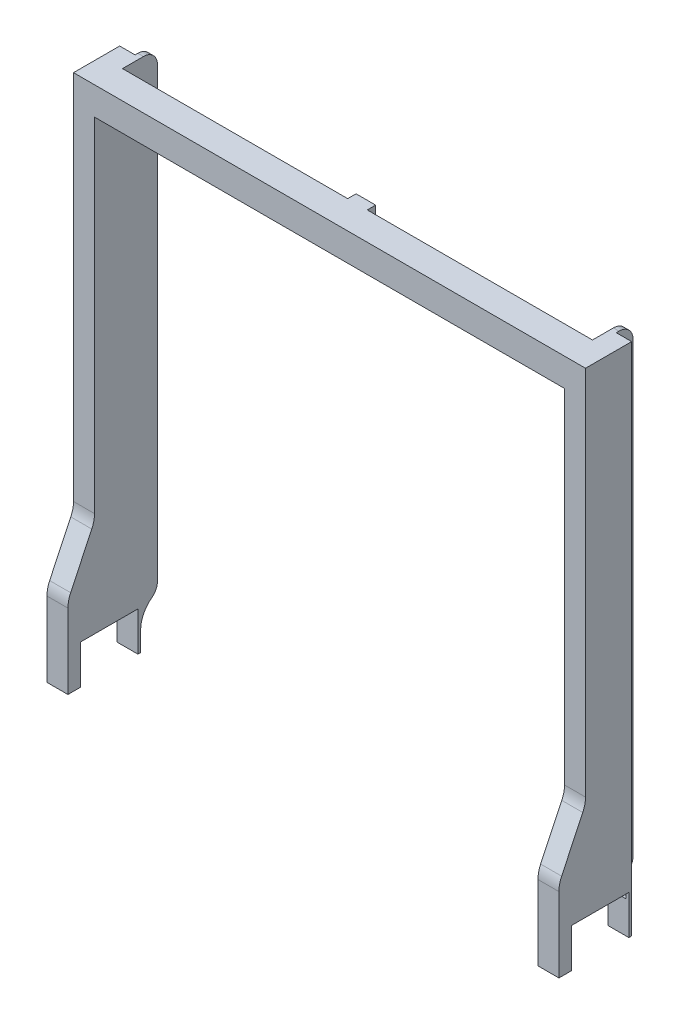
from build123d import *

# Parameters (mm, degrees)
EXTRUDE_1_DEPTH        = 26
EXTRUDE_2_DEPTH        = 19
FILLET_1_R             = 10
SKETCH_5_W             = 161
SKETCH_5_H             = 6
CUT_EXTRUDE_1_DEPTH    = 52
SKETCH_1_5_W           = 11
SKETCH_1_5_H           = 340
EXTRUDE_4_DEPTH        = 7
SKETCH_6_W             = 1.9
SKETCH_6_H             = 2
SKETCH_6_W_2           = 6.6
EXTRUDE_5_DEPTH        = 28
SKETCH_6_3_W           = 6.6
SKETCH_6_3_H           = 2
CUT_EXTRUDE_2_DEPTH    = 5
FILLET_2_R             = 20
SKETCH_6_4_W           = 15
SKETCH_6_4_H           = 10
SKETCH_6_4_H_2         = 9
EXTRUDE_6_DEPTH        = 30
SKETCH_6_5_W           = 15
SKETCH_6_5_H           = 9
EXTRUDE_7_DEPTH        = 28
EXTRUDE_8_DEPTH        = 15
FILLET_3_R             = 20
FILLET_3_OF_MIRROR_2_R = 20
FILLET_4_R             = 20


with BuildPart() as part:
    # 스케치1 → 보스-돌출1 (new body)
    with BuildSketch(Plane.XY):
        Polygon((-168, 0), (168, 0), (183, 0), (183, -340), (168, -340), (168, -20), (-168, -20), (-168, -340), (-183, -340), (-183, 0), align=None)
    extrude(amount=EXTRUDE_1_DEPTH)

    # 스케치1<4> → 보스-돌출2 (add)
    with BuildSketch(Plane.XY):
        Polygon((172, 0), (168, 0), (168, -20), (168, -340), (172, -340), align=None)
        Polygon((-168, -20), (-168, 0), (-172, 0), (-172, -340), (-168, -340), align=None)
    extrude(amount=-EXTRUDE_2_DEPTH)

    # 필렛1
    fillet_1_edges = [part.edges().sort_by_distance(p)[0] for p in [
        (170, 0, -19),
        (170, -340, -19),
        (-170, -340, -19),
        (-170, 0, -19),
    ]]
    fillet(fillet_1_edges, radius=FILLET_1_R)

    # 스케치5 → 컷-돌출1 (cut)
    with BuildSketch(Plane(origin=(0, 0, 0), x_dir=(1, 0, 0), z_dir=(0, 1, 0))):
        with Locations((-87.5, -3)):
            Rectangle(SKETCH_5_W, SKETCH_5_H)
        with Locations((87.5, -3)):
            Rectangle(SKETCH_5_W, SKETCH_5_H)
    extrude(amount=-CUT_EXTRUDE_1_DEPTH, mode=Mode.SUBTRACT)

    # 스케치1<5> → 보스-돌출4 (add)
    with BuildSketch(Plane.XY):
        with Locations((177.5, -170)):
            Rectangle(SKETCH_1_5_W, SKETCH_1_5_H)
        with Locations((-177.5, -170)):
            Rectangle(SKETCH_1_5_W, SKETCH_1_5_H)
    extrude(amount=-EXTRUDE_4_DEPTH)

    # 스케치6 → 보스-돌출5 (add)
    with BuildSketch(Plane.XZ.offset(340)):
        with Locations((-182.05, -6)):
            Rectangle(SKETCH_6_W, SKETCH_6_H)
        with Locations((-177.8, -6)):
            Rectangle(SKETCH_6_W_2, SKETCH_6_H)
        Polygon((-174.5, -7), (-172, -7), (-168, -7), (-168, -5), (-174.5, -5), align=None)
    extrude_5 = extrude(amount=EXTRUDE_5_DEPTH)

    # 스케치6<3> → 컷-돌출2 (cut)
    with BuildSketch(Plane.XZ.offset(340)):
        with Locations((-177.8, -6)):
            Rectangle(SKETCH_6_3_W, SKETCH_6_3_H)
    cut_extrude_2 = extrude(amount=CUT_EXTRUDE_2_DEPTH, mode=Mode.SUBTRACT)

    # 필렛2
    # the kernel refuses this fillet: 20 mm, written as the material it adds along each edge
    with BuildSketch(Plane(origin=(-172, -340, -7), x_dir=(0, -1, 0), z_dir=(1, 0, 0))) as fillet_2_piece_1:
        with BuildLine():
            CenterArc((14, 20), FILLET_2_R, 216.869897646, 53.130102354)
            Line((-2, 8), (-3.6, 6.8))
            ThreePointArc((-3.6, 6.8), (-2, 2), (-2, 0))
            Line((-2, 0), (0, -2))
            Line((0, -2), (14, -2))
            Line((14, -2), (14, 0))
        make_face()
    extrude(amount=4)

    # 스케치6<4> → 보스-돌출6 (add)
    with BuildSketch(Plane.XZ.offset(340)):
        with Locations((-175.5, 31)):
            Rectangle(SKETCH_6_4_W, SKETCH_6_4_H)
        with Locations((-175.5, 40.5)):
            Rectangle(SKETCH_6_4_W, SKETCH_6_4_H_2)
    extrude_6 = extrude(amount=-EXTRUDE_6_DEPTH)

    # 스케치6<5> → 보스-돌출7 (add)
    with BuildSketch(Plane.XZ.offset(340)):
        with Locations((-175.5, 40.5)):
            Rectangle(SKETCH_6_5_W, SKETCH_6_5_H)
    extrude_7 = extrude(amount=EXTRUDE_7_DEPTH)

    # 스케치9 → 보스-돌출8 (add)
    with BuildSketch(Plane.ZY.offset(183)):
        Polygon((26, -310), (45, -310), (26, -270), align=None)
    extrude_8 = extrude(amount=-EXTRUDE_8_DEPTH)

    # 필렛3
    fillet_3_edges = [part.edges().sort_by_distance(p)[0] for p in [
        (-175.5, -310, 45),
        (-175.5, -270, 26),
    ]]
    fillet(fillet_3_edges, radius=FILLET_3_R)

    # 대칭 복사2: 보스-돌출5, 컷-돌출2, 보스-돌출6, 보스-돌출7, 보스-돌출8 across plane
    add(extrude_5.mirror(Plane(origin=(0, 0, 0), x_dir=(0, 0, 1), z_dir=(1, 0, 0))))
    add(cut_extrude_2.mirror(Plane(origin=(0, 0, 0), x_dir=(0, 0, 1), z_dir=(1, 0, 0))), mode=Mode.SUBTRACT)
    add(extrude_6.mirror(Plane(origin=(0, 0, 0), x_dir=(0, 0, 1), z_dir=(1, 0, 0))))
    add(extrude_7.mirror(Plane(origin=(0, 0, 0), x_dir=(0, 0, 1), z_dir=(1, 0, 0))))
    add(extrude_8.mirror(Plane(origin=(0, 0, 0), x_dir=(0, 0, 1), z_dir=(1, 0, 0))))

    # 필렛3 of 대칭 복사2
    fillet_3_of_mirror_2_edges = [part.edges().sort_by_distance(p)[0] for p in [
        (175.5, -310, 45),
        (175.5, -270, 26),
    ]]
    fillet(fillet_3_of_mirror_2_edges, radius=FILLET_3_OF_MIRROR_2_R)

    # 필렛4
    # the kernel refuses this fillet: 20 mm, written as the material it adds along each edge
    with BuildSketch(Plane(origin=(172, -340, -7), x_dir=(0, 0.24253562503633938, -0.9701425001453302), z_dir=(-1, 0, 0))) as fillet_4_piece_1:
        with BuildLine():
            CenterArc((16.007351252, 18.432707503), FILLET_4_R, 194.036243468, 53.130102354)
            Line((-3.395498751, 13.581995002), (-5.335783751, 13.096923752))
            Line((-5.335783751, 13.096923752), (-1.940285, -0.48507125))
            Line((-1.940285, -0.48507125), (0.48507125, -1.940285))
            ThreePointArc((0.48507125, -1.940285), (2.42535625, -1.45521375), (7.470097251, -1.84327075))
            Line((7.470097251, -1.84327075), (8.246211251, 0))
        make_face()
    extrude(amount=4)


solid = part.part
